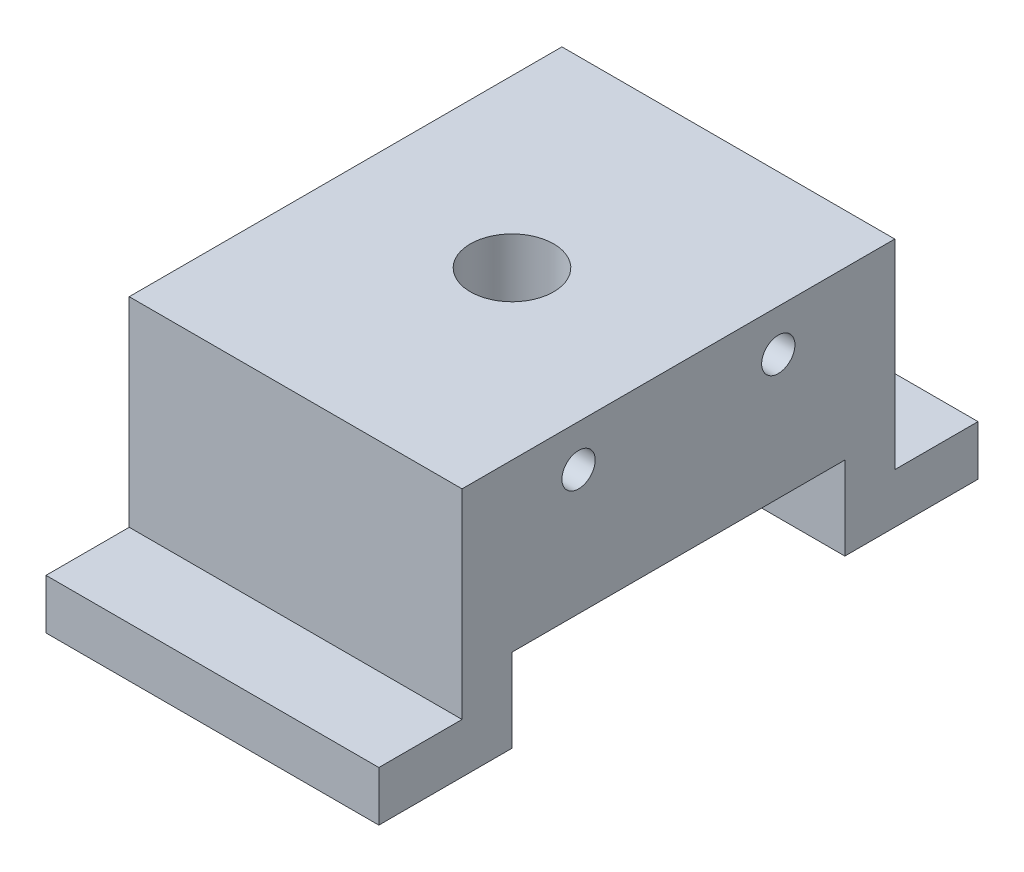
from build123d import *

# Parameters (mm, degrees)
SKETCH1_R           = 1
BOSS_EXTRUDE1_DEPTH = 10
SKETCH2_R           = 7
CUT_EXTRUDE1_DEPTH  = 5
SKETCH3_R           = 2.5
CUT_EXTRUDE2_DEPTH  = 23.891046285


with BuildPart() as part:
    # Sketch1 → Boss-Extrude1 (new, symmetric)
    with BuildSketch(Plane(origin=(0, 0, 0), x_dir=(0, 0, -1), z_dir=(1, 0, 0))):
        Polygon((-10, 0), (-18, 0), (-18, 3), (-13, 3), (-13, 15), (13, 15), (13, 3), (18, 3), (18, 0), (10, 0), (10, 5), (-10, 5), align=None)
        with Locations((-6, 12.5)):
            Circle(SKETCH1_R, mode=Mode.SUBTRACT)
        with Locations((6, 12.5)):
            Circle(SKETCH1_R, mode=Mode.SUBTRACT)
    extrude(amount=BOSS_EXTRUDE1_DEPTH, both=True)

    # Sketch2 → Cut-Extrude1 (cut)
    with BuildSketch(Plane.XZ.offset(-5)):
        Circle(SKETCH2_R)
    extrude(amount=-CUT_EXTRUDE1_DEPTH, mode=Mode.SUBTRACT)

    # Sketch3 → Cut-Extrude2 (cut, through all)
    with BuildSketch(Plane.XZ.offset(-10)):
        Circle(SKETCH3_R)
    extrude(amount=-CUT_EXTRUDE2_DEPTH, mode=Mode.SUBTRACT)


solid = part.part
